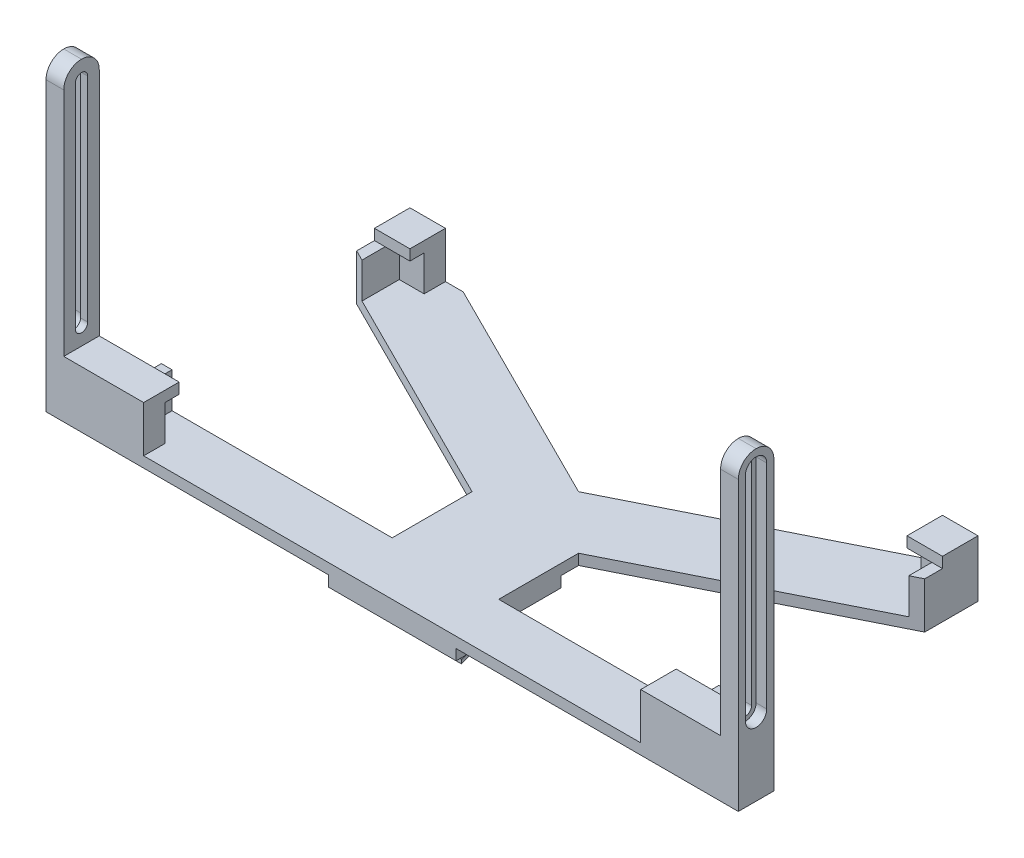
from build123d import *

# Parameters (mm, degrees)
EXTRUDE_1_DEPTH        = 4
CHAMFER_1_SIZE         = 3
CUT_EXTRUDE_1_DEPTH    = 33.687918257
SKETCH_3_R             = 9.557368967
EXTRUDE_2_DEPTH        = 3
CUT_EXTRUDE_2_DEPTH    = 2
SKETCH_7_R             = 2
CUT_EXTRUDE_3_DEPTH    = 34.188853551
FILLET_2_R             = 1
SKETCH_9_W             = 36
SKETCH_9_H             = 32.5
SKETCH_9_R             = 9.557368967
EXTRUDE_4_DEPTH        = 3
SKETCH_10_W            = 160
SKETCH_10_H            = 85
EXTRUDE_5_DEPTH        = 3
SKETCH_11_W            = 3
SKETCH_11_H            = 85
EXTRUDE_6_DEPTH        = 10
SKETCH_12_W            = 10
SKETCH_12_H            = 6
EXTRUDE_7_DEPTH        = 10
SKETCH_13_W            = 10
SKETCH_13_H            = 10
EXTRUDE_8_DEPTH        = 3
SKETCH_15_W            = 10
SKETCH_15_H            = 16
EXTRUDE_10_DEPTH       = 12.5
SKETCH_17_W            = 10
SKETCH_17_H            = 86
EXTRUDE_11_DEPTH       = 5
CUT_EXTRUDE_5_DEPTH    = 213.052469922
CUT_EXTRUDE_6_DEPTH    = 3
FILLET_3_R             = 5
FILLET_3_OF_MIRROR_2_R = 5
CUT_EXTRUDE_7_DEPTH    = 147.274570586


with BuildPart() as part:
    # 草图1 → 凸台-拉伸1 (new body)
    with BuildSketch(Plane(origin=(0, 0, 0), x_dir=(1, 0, 0), z_dir=(0, 1, 0))):
        Polygon((-8, 28.5), (8, 28.5), (15.5, 0), (-15.5, 0), align=None)
    extrude(amount=EXTRUDE_1_DEPTH)

    # Chamfer 1
    chamfer_1_edges = [part.edges().sort_by_distance(p)[0] for p in [
        (11.75, 4, -14.25),
        (-11.75, 4, -14.25),
    ]]
    chamfer(chamfer_1_edges, length=CHAMFER_1_SIZE)

    # 草图2 → 切除-拉伸1 (cut, through all)
    with BuildSketch(Plane(origin=(0, 4, 0), x_dir=(1, 0, 0), z_dir=(0, 1, 0))):
        Polygon((-4.897860626, 28.5), (-9.315789474, 23.5), (-9.315789474, 28.5), align=None)
        Polygon((9.315789474, 28.5), (4.897860626, 28.5), (9.315789474, 23.5), align=None)
    extrude(amount=-CUT_EXTRUDE_1_DEPTH, mode=Mode.SUBTRACT)

    # 草图3 → 凸台-拉伸2 (add)
    with BuildSketch(Plane(origin=(0, 4, 0), x_dir=(1, 0, 0), z_dir=(0, 1, 0))):
        with Locations(Location((0, 9.557368967, 0), (0, 0, 270))):
            Circle(SKETCH_3_R)
    extrude(amount=EXTRUDE_2_DEPTH)

    # 草图5 → 切除-拉伸2 (cut)
    with BuildSketch(Plane.XZ):
        Polygon((-7.5, -24), (7.5, -24), (7.5, -22), (6, -22), (6, -4), (-6, -4), (-6, -22), (-7.5, -22), align=None)
    extrude(amount=-CUT_EXTRUDE_2_DEPTH, mode=Mode.SUBTRACT)

    # 草图7 → 切除-拉伸3 (cut, through all)
    with BuildSketch(Plane(origin=(0, 7, 0), x_dir=(1, 0, 0), z_dir=(0, 1, 0))):
        with Locations(Location((0, 9.557368967, 0), (0, 0, 270))):
            Circle(SKETCH_7_R)
    extrude(amount=-CUT_EXTRUDE_3_DEPTH, mode=Mode.SUBTRACT)

    # 草图8 → 切除-旋转1 (revolve, cut)
    with BuildSketch(Plane(origin=(0, 0, 0), x_dir=(0, 0, -1), z_dir=(1, 0, 0)), mode=Mode.PRIVATE) as cut_revolve_1_sk:
        Polygon((7.557368967, 5), (5.557368967, 3), (5.557368967, 2), (9.557368967, 2), (9.557368967, 5), align=None)
    revolve(cut_revolve_1_sk.sketch.rotate(Axis((0, -993, -9.557368967), (0, 1, 0)), 180), axis=Axis((0, -993, -9.557368967), (0, 1, 0)), mode=Mode.SUBTRACT)

    # 圆角2
    fillet_2_edges = [part.edges().sort_by_distance(p)[0] for p in [
        (-7.5, 1, -22),
        (-7.5, 1, -24),
        (7.5, 1, -24),
        (7.5, 1, -22),
    ]]
    fillet(fillet_2_edges, radius=FILLET_2_R - 0.0001)  # a hair under: the kernel refuses the full size

    # 草图9 → 凸台-拉伸4 (add)
    with BuildSketch(Plane(origin=(0, 4, 0), x_dir=(1, 0, 0), z_dir=(0, 1, 0))):
        with Locations((0, 12.25)):
            Rectangle(SKETCH_9_W, SKETCH_9_H)
        with Locations((0, 9.557368967)):
            Circle(SKETCH_9_R, mode=Mode.SUBTRACT)
    extrude(amount=EXTRUDE_4_DEPTH)

    # 草图10 → 凸台-拉伸5 (add)
    with BuildSketch(Plane(origin=(0, 7, 0), x_dir=(1, 0, 0), z_dir=(0, 1, 0))):
        with Locations((0, 38.5)):
            Rectangle(SKETCH_10_W, SKETCH_10_H)
    extrude(amount=EXTRUDE_5_DEPTH)

    # 草图11 → 凸台-拉伸6 (add)
    with BuildSketch(Plane(origin=(0, 10, 0), x_dir=(1, 0, 0), z_dir=(0, 1, 0))):
        with Locations((-78.5, 38.5)):
            Rectangle(SKETCH_11_W, SKETCH_11_H)
        with Locations((78.5, 38.5)):
            Rectangle(SKETCH_11_W, SKETCH_11_H)
    extrude(amount=EXTRUDE_6_DEPTH)

    # 草图12 → 凸台-拉伸7 (add)
    with BuildSketch(Plane(origin=(0, 10, 0), x_dir=(1, 0, 0), z_dir=(0, 1, 0))):
        with Locations((-75, 78)):
            Rectangle(SKETCH_12_W, SKETCH_12_H)
        with Locations((75, 78)):
            Rectangle(SKETCH_12_W, SKETCH_12_H)
        with Locations((75, -1)):
            Rectangle(SKETCH_12_W, SKETCH_12_H)
        with Locations((-75, -1)):
            Rectangle(SKETCH_12_W, SKETCH_12_H)
    extrude(amount=EXTRUDE_7_DEPTH)

    # 草图13 → 凸台-拉伸8 (add)
    with BuildSketch(Plane(origin=(0, 20, 0), x_dir=(1, 0, 0), z_dir=(0, 1, 0))):
        with Locations((-75, 76)):
            Rectangle(SKETCH_13_W, SKETCH_13_H)
        with Locations((-75, 1)):
            Rectangle(SKETCH_13_W, SKETCH_13_H)
        with Locations((75, 76)):
            Rectangle(SKETCH_13_W, SKETCH_13_H)
        with Locations((75, 1)):
            Rectangle(SKETCH_13_W, SKETCH_13_H)
    extrude(amount=EXTRUDE_8_DEPTH)

    # 草图15 → 凸台-拉伸10 (add)
    with BuildSketch(Plane.ZY.offset(80)):
        with Locations((-1, 15)):
            Rectangle(SKETCH_15_W, SKETCH_15_H)
    extrude_10 = extrude(amount=EXTRUDE_10_DEPTH)

    # 草图17 → 凸台-拉伸11 (add)
    with BuildSketch(Plane.ZY.offset(92.5)):
        with Locations((-1, 50)):
            Rectangle(SKETCH_17_W, SKETCH_17_H)
    extrude_11 = extrude(amount=EXTRUDE_11_DEPTH)

    # 草图19 → 切除-拉伸5 (cut, symmetric)
    with BuildSketch(Plane(origin=(-92.5, 0, 0), x_dir=(0, 0, -1), z_dir=(1, 0, 0))):
        with BuildLine():
            Line((2.75, 88), (2.75, 28))
            ThreePointArc((2.75, 28), (1, 26.25), (-0.75, 28))
            Line((-0.75, 28), (-0.75, 88))
            ThreePointArc((-0.75, 88), (1, 89.75), (2.75, 88))
        make_face()
    cut_extrude_5 = extrude(amount=CUT_EXTRUDE_5_DEPTH, both=True, mode=Mode.SUBTRACT)

    # 草图20 → 切除-拉伸6 (cut)
    with BuildSketch(Plane.ZY.offset(97.5)):
        with BuildLine():
            Line((2, 88), (2, 28))
            ThreePointArc((2, 28), (-1, 25), (-4, 28))
            Line((-4, 28), (-4, 88))
            ThreePointArc((-4, 88), (-1, 91), (2, 88))
        make_face()
    cut_extrude_6 = extrude(amount=-CUT_EXTRUDE_6_DEPTH, mode=Mode.SUBTRACT)

    # 圆角3
    fillet_3_edges = [part.edges().sort_by_distance(p)[0] for p in [
        (-95, 93, 4),
        (-95, 93, -6),
    ]]
    fillet(fillet_3_edges, radius=FILLET_3_R - 0.0001)  # a hair under: the kernel refuses the full size

    # 镜向2: 凸台-拉伸10, 凸台-拉伸11, 切除-拉伸5, 切除-拉伸6 across plane
    add(extrude_10.mirror(Plane(origin=(0, 0, 0), x_dir=(0, 0, 1), z_dir=(1, 0, 0))))
    add(extrude_11.mirror(Plane(origin=(0, 0, 0), x_dir=(0, 0, 1), z_dir=(1, 0, 0))))
    add(cut_extrude_5.mirror(Plane(origin=(0, 0, 0), x_dir=(0, 0, 1), z_dir=(1, 0, 0))), mode=Mode.SUBTRACT)
    add(cut_extrude_6.mirror(Plane(origin=(0, 0, 0), x_dir=(0, 0, 1), z_dir=(1, 0, 0))), mode=Mode.SUBTRACT)

    # 圆角3 of 镜向2
    fillet_3_of_mirror_2_edges = [part.edges().sort_by_distance(p)[0] for p in [
        (95, 93, 4),
        (95, 93, -6),
    ]]
    fillet(fillet_3_of_mirror_2_edges, radius=FILLET_3_OF_MIRROR_2_R - 0.0001)  # a hair under: the kernel refuses the full size

    # 草图21 → 切除-拉伸7 (cut, through all)
    with BuildSketch(Plane(origin=(0, 20, 0), x_dir=(1, 0, 0), z_dir=(0, 1, 0))):
        Polygon((-65, 81), (65, 81), (0, 48.5), align=None)
        Polygon((-80, 66), (-15, 33.5), (-15, 11), (-80, 11), align=None)
        Polygon((15, 11), (80, 11), (80, 66), (15, 33.5), align=None)
    extrude(amount=-CUT_EXTRUDE_7_DEPTH, mode=Mode.SUBTRACT)


solid = part.part
